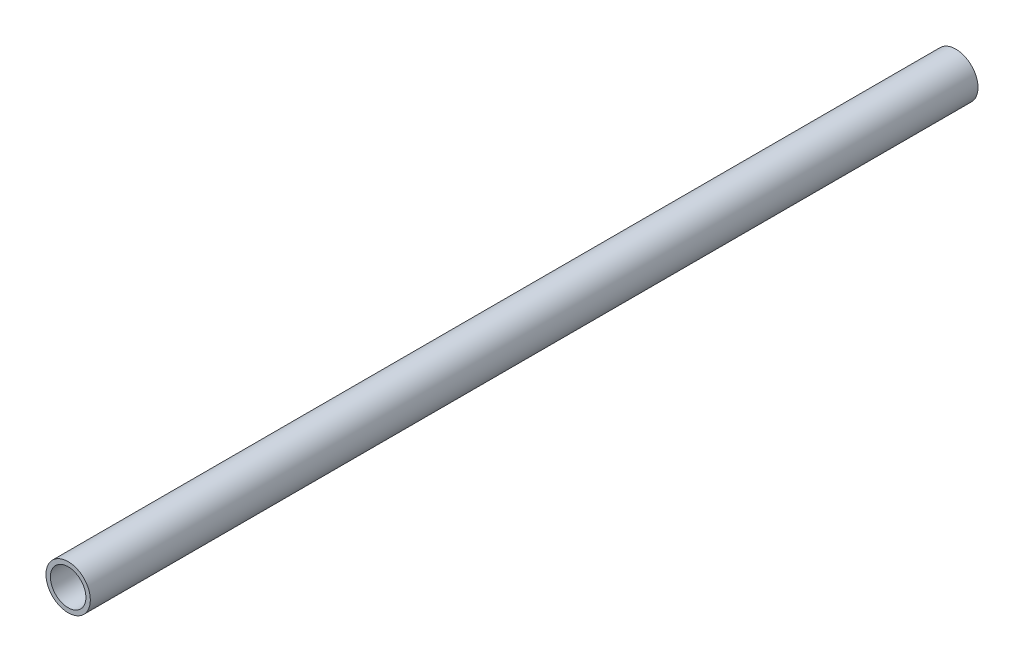
from build123d import *

# Parameters (mm, degrees)
SKETCH1_R           = 10
SKETCH1_R_2         = 8
BOSS_EXTRUDE1_DEPTH = 400


with BuildPart() as part:
    # Sketch1 → Boss-Extrude1 (new body)
    with BuildSketch(Plane.XY):
        Circle(SKETCH1_R)
        Circle(SKETCH1_R_2, mode=Mode.SUBTRACT)
    extrude(amount=BOSS_EXTRUDE1_DEPTH)


solid = part.part
